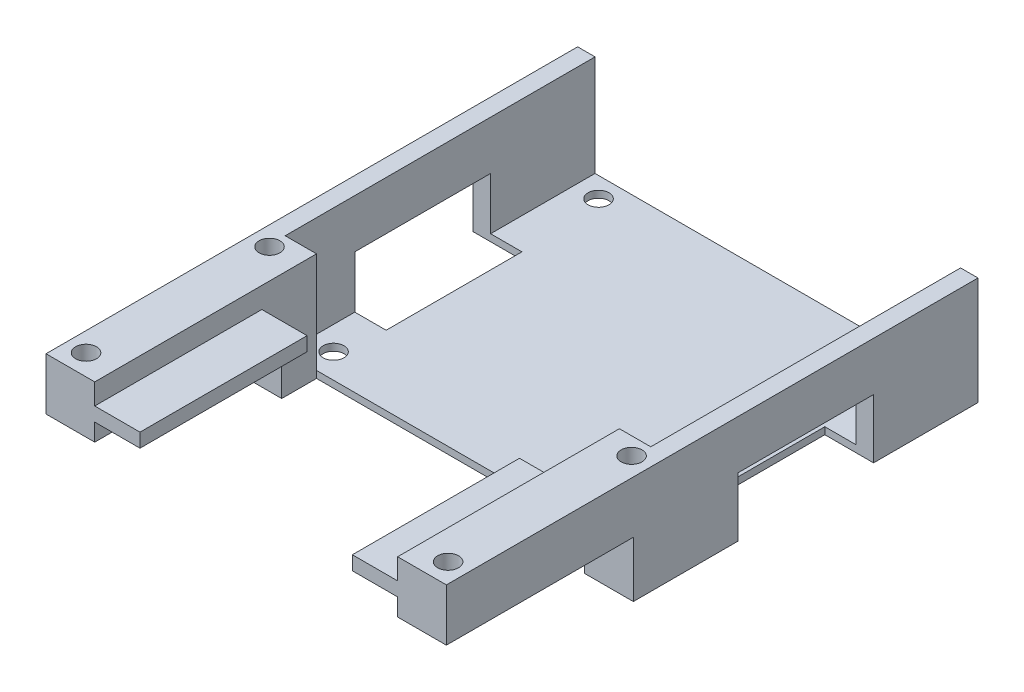
from build123d import *

# Parameters (mm, degrees)
SKETCH1_W                = 52.5
SKETCH1_H                = 44.5
BOSS_EXTRUDE1_DEPTH      = 1
BOSS_EXTRUDE2_DEPTH      = 15.5
F_3_0_3_DIAMETER_HOLE1_D = 3
SKETCH6_W                = 6.5
SKETCH6_H                = 2
BOSS_EXTRUDE3_DEPTH      = 24
SKETCH6_4_W              = 7
SKETCH6_4_H              = 8
CUT_EXTRUDE1_DEPTH       = 26.85
SKETCH8_W                = 7
SKETCH8_H                = 19.5
CUT_EXTRUDE2_DEPTH       = 8.5
CUT_EXTRUDE3_DEPTH       = 0.3


with BuildPart() as part:
    # Sketch1 → Boss-Extrude1 (new body)
    with BuildSketch(Plane(origin=(0, 0, 0), x_dir=(1, 0, 0), z_dir=(0, 1, 0))):
        with Locations((0, 54.1)):
            Rectangle(SKETCH1_W, SKETCH1_H)
    extrude(amount=BOSS_EXTRUDE1_DEPTH)

    # Sketch1<3> → Boss-Extrude2 (add)
    with BuildSketch(Plane(origin=(0, 0, 0), x_dir=(1, 0, 0), z_dir=(0, 1, 0))):
        Polygon((-26.25, 76.35), (-28.75, 76.35), (-28.75, 0), (-21.75, 0), (-21.75, 31.85), (-26.25, 31.85), align=None)
        Polygon((28.75, 76.35), (26.25, 76.35), (26.25, 31.85), (21.75, 31.85), (21.75, 0), (28.75, 0), align=None)
    extrude(amount=BOSS_EXTRUDE2_DEPTH)

    # Ø3.0 (3) Diameter Hole1 (through all)
    with Locations(Plane(origin=(0, 0, 0), x_dir=(-1, 0, 0), z_dir=(0, -1, 0))):
        with Locations((-22.85, 73.45), (22.85, 73.45), (26, 29.35), (22.85, 35.4), (-22.85, 35.4), (-26, 29.35), (-26, 3), (26, 3), (-30.25, 71.35), (30.25, 71.35)):
            Hole(F_3_0_3_DIAMETER_HOLE1_D / 2)

    # Sketch6 → Boss-Extrude3 (add)
    with BuildSketch(Plane.XY):
        with Locations((-18.5, 11.5)):
            Rectangle(SKETCH6_W, SKETCH6_H)
        with Locations((18.5, 11.5)):
            Rectangle(SKETCH6_W, SKETCH6_H)
    extrude(amount=-BOSS_EXTRUDE3_DEPTH)

    # Sketch6<4> → Cut-Extrude1 (cut)
    with BuildSketch(Plane.XY):
        with Locations((-25.25, 4)):
            Rectangle(SKETCH6_4_W, SKETCH6_4_H)
        with Locations((25.25, 4)):
            Rectangle(SKETCH6_4_W, SKETCH6_4_H)
    extrude(amount=-CUT_EXTRUDE1_DEPTH, mode=Mode.SUBTRACT)

    # Sketch8 → Cut-Extrude2 (cut)
    with BuildSketch(Plane.XZ):
        with Locations((-25.25, -51.6)):
            Rectangle(SKETCH8_W, SKETCH8_H)
        with Locations((25.25, -51.6)):
            Rectangle(SKETCH8_W, SKETCH8_H)
    extrude(amount=-CUT_EXTRUDE2_DEPTH, mode=Mode.SUBTRACT)

    # Sketch9 → Cut-Extrude3 (cut)
    with BuildSketch(Plane.XZ):
        Polygon((-3.425965173, -64.920888862), (-1.429787021, -53.6), (-9.429787021, -53.6), (3.425965173, -38.279111138), (1.429787021, -49.6), (9.429787021, -49.6), align=None)
    extrude(amount=-CUT_EXTRUDE3_DEPTH, mode=Mode.SUBTRACT)


solid = part.part
